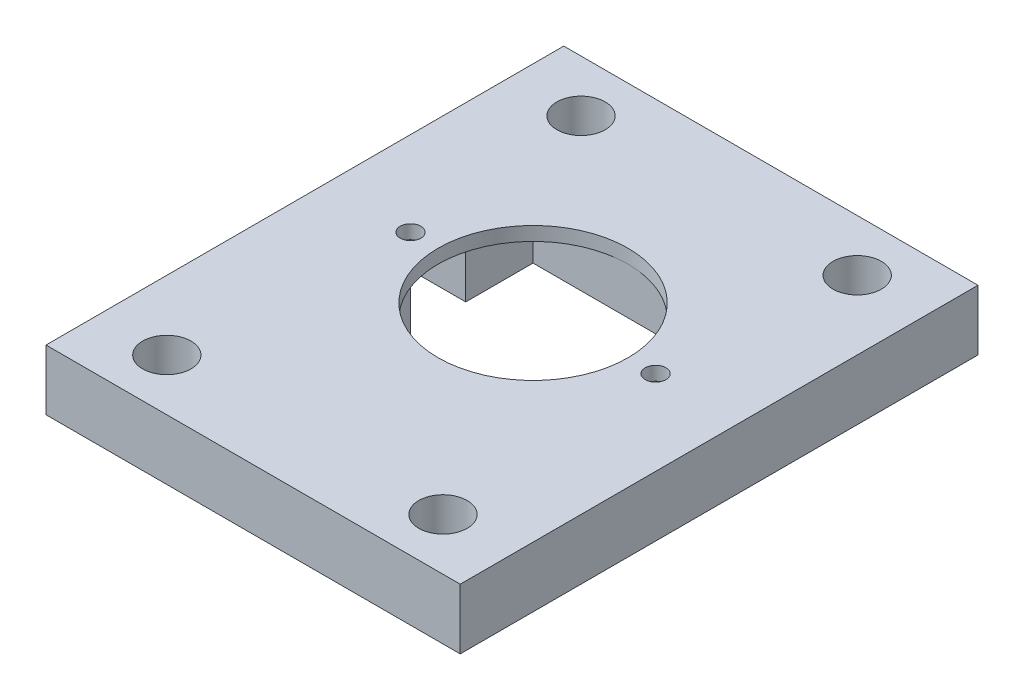
from build123d import *

# Parameters (mm, degrees)
SKETCH1_W           = 30.48
SKETCH1_H           = 38.1
SKETCH1_R           = 1.778
BOSS_EXTRUDE1_DEPTH = 4.445
SKETCH2_R           = 1.778
SKETCH2_R_2         = 6.985
SKETCH2_R_3         = 0.762
CUT_EXTRUDE1_DEPTH  = 25.797542721
SKETCH3_R           = 0.762
CUT_EXTRUDE2_DEPTH  = 3.429


with BuildPart() as part:
    # Sketch1 → Boss-Extrude1 (new body)
    with BuildSketch(Plane(origin=(0, 0, 0), x_dir=(1, 0, 0), z_dir=(0, 1, 0))):
        Rectangle(SKETCH1_W, SKETCH1_H)
        with Locations((-10.16, 15.24)):
            Circle(SKETCH1_R, mode=Mode.SUBTRACT)
        with Locations((10.16, 15.24)):
            Circle(SKETCH1_R, mode=Mode.SUBTRACT)
        with Locations((-10.16, -15.24)):
            Circle(SKETCH1_R, mode=Mode.SUBTRACT)
        with Locations((10.16, -15.24)):
            Circle(SKETCH1_R, mode=Mode.SUBTRACT)
    extrude(amount=BOSS_EXTRUDE1_DEPTH)

    # Sketch2 → Cut-Extrude1 (cut, through all)
    with BuildSketch(Plane.XZ):
        with Locations((-10.16, -15.24)):
            Circle(SKETCH2_R)
        with Locations((10.16, -15.24)):
            Circle(SKETCH2_R)
        with Locations((10.16, 15.24)):
            Circle(SKETCH2_R)
        with Locations((-10.16, 15.24)):
            Circle(SKETCH2_R)
        with Locations((0, -1.5494)):
            Circle(SKETCH2_R_2)
        with Locations((-9.017, -1.5494)):
            Circle(SKETCH2_R_3)
        with Locations((9.017, -1.5494)):
            Circle(SKETCH2_R_3)
    extrude(amount=-CUT_EXTRUDE1_DEPTH, mode=Mode.SUBTRACT)

    # Sketch3 → Cut-Extrude2 (cut)
    # profile 1 of 2: a face of its own
    with BuildSketch(Plane.XZ):
        with BuildLine():
            Line((-6.985, -3.5814), (-6.985, -8.5344))
            Line((-6.985, -8.5344), (0, -8.5344))
            ThreePointArc((0, -8.5344), (-6.985, -1.549399996), (9e-09, 5.4356))
            Line((9e-09, 5.4356), (-6.985, 5.4356))
            Line((-6.985, 5.4356), (-6.985, 0.4826))
            Line((-6.985, 0.4826), (-11.049, 0.4826))
            Line((-11.049, 0.4826), (-11.049, -3.5814))
            Line((-11.049, -3.5814), (-6.985, -3.5814))
        make_face()
        with Locations((-9.017, -1.5494)):
            Circle(SKETCH3_R, mode=Mode.SUBTRACT)
    # profile 2 of 2: a face of its own
    with BuildSketch(Plane.XZ):
        with BuildLine():
            Line((0, -8.5344), (6.985, -8.5344))
            Line((6.985, -8.5344), (6.985, -3.5814))
            Line((6.985, -3.5814), (11.049, -3.5814))
            Line((11.049, -3.5814), (11.049, 0.4826))
            Line((11.049, 0.4826), (6.985, 0.4826))
            Line((6.985, 0.4826), (6.985, 5.4356))
            Line((6.985, 5.4356), (9e-09, 5.4356))
            ThreePointArc((9e-09, 5.4356), (6.985, -1.549400004), (0, -8.5344))
        make_face()
    extrude(amount=-CUT_EXTRUDE2_DEPTH, mode=Mode.SUBTRACT)


solid = part.part
